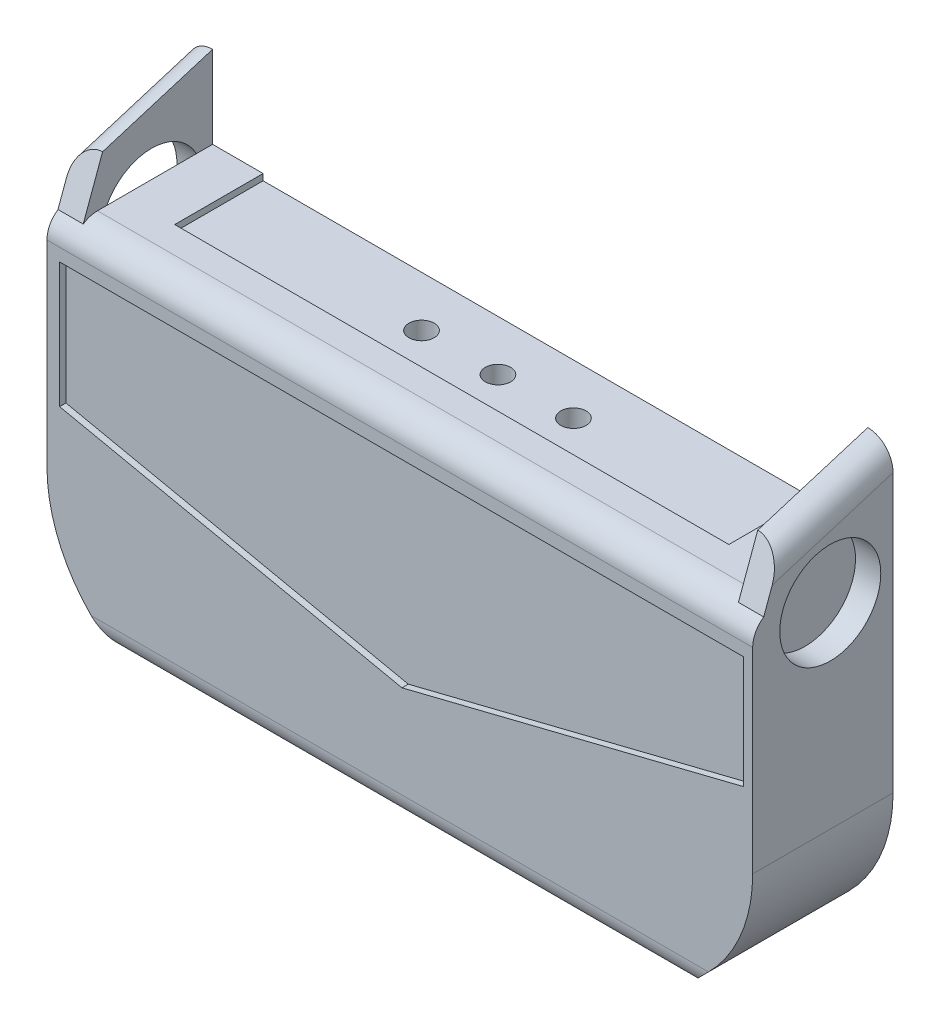
from build123d import *

# Parameters (mm, degrees)
SKETCH4_W                      = 111.737645783
SKETCH4_H                      = 62.825705526
BOSS_EXTRUDE3_DEPTH            = 20.22630919
SKETCH5_W                      = 103.737645783
SKETCH5_H                      = 6.825139403
CUT_EXTRUDE1_DEPTH             = 131.749158903
CUT_EXTRUDE2_DEPTH             = 131.749158903
SKETCH7_W                      = 87.737645783
SKETCH7_H                      = 14
CUT_EXTRUDE3_DEPTH             = 1
SKETCH8_W                      = 87.737645783
SKETCH8_H                      = 14
CUT_EXTRUDE4_DEPTH             = 1
DRAFT1_ANGLE                   = 17.058179216
F_16_0_16_DIAMETER_HOLE1_D     = 16
F_16_0_16_DIAMETER_HOLE1_DEPTH = 4
F_16_0_16_DIAMETER_HOLE2_D     = 16
F_16_0_16_DIAMETER_HOLE2_DEPTH = 4
F_4_0_4_DIAMETER_HOLE1_D       = 4
F_4_0_4_DIAMETER_HOLE1_DEPTH   = 6
F_4_0_4_DIAMETER_HOLE2_D       = 4
F_4_0_4_DIAMETER_HOLE2_DEPTH   = 68.031973705
M10_CLEARANCE_HOLE1_D          = 11.9
CHAMFER1_SIZE                  = 6.825139403
CHAMFER1_SIZE2                 = 2.933140798
CHAMFER2_SIZE                  = 6.825139403
CHAMFER2_SIZE2                 = 2.933140798
SKETCH19_W                     = 111.737645783
SKETCH19_H                     = 56.000566123
BOSS_EXTRUDE4_DEPTH            = 2
FILLET7_R                      = 4
CHAMFER3_SIZE                  = 11
CHAMFER4_SIZE                  = 11
FILLET9_R                      = 24
FILLET10_R                     = 24
CUT_EXTRUDE6_DEPTH             = 1
FILLET13_R                     = 4
FILLET14_R                     = 4
FILLET15_R                     = 4


# Some blends are built 0.0001 mm under size
with BuildPart() as part:
    # Sketch4 → Boss-Extrude3 (new body)
    with BuildSketch(Plane(origin=(0, 0, 67.988216463), x_dir=(-1, 0, 0), z_dir=(0, 0, -1))):
        with Locations((-27.467757585, 67.284935079)):
            Rectangle(SKETCH4_W, SKETCH4_H)
    extrude(amount=-BOSS_EXTRUDE3_DEPTH)

    # Sketch5 → Cut-Extrude1 (cut, through all)
    with BuildSketch(Plane.XY.offset(88.214525653)):
        with Locations((27.467757585, 95.285218141)):
            Rectangle(SKETCH5_W, SKETCH5_H)
    extrude(amount=-CUT_EXTRUDE1_DEPTH, mode=Mode.SUBTRACT)

    # Sketch6 → Cut-Extrude2 (cut, through all)
    with BuildSketch(Plane.XY.offset(88.214525653)):
        with BuildLine():
            Line((-21.401065306, 66.205832154), (-21.401065306, 42.872082316))
            Line((-21.401065306, 42.872082316), (76.336580477, 42.872082316))
            Line((76.336580477, 42.872082316), (76.336580477, 66.098543331))
            ThreePointArc((76.336580477, 66.098543331), (63.931745492, 73.877367201), (76.336580477, 81.65619107))
            Line((76.336580477, 81.65619107), (76.336580477, 84.872648439))
            Line((76.336580477, 84.872648439), (-21.401065306, 84.872648439))
            Line((-21.401065306, 84.872648439), (-21.401065306, 81.548902247))
            ThreePointArc((-21.401065306, 81.548902247), (-8.768867408, 73.877367201), (-21.401065306, 66.205832154))
        make_face()
    extrude(amount=-CUT_EXTRUDE2_DEPTH, mode=Mode.SUBTRACT)

    # Sketch7 → Cut-Extrude3 (cut)
    with BuildSketch(Plane(origin=(0, 91.872648439, 0), x_dir=(-1, 0, 0), z_dir=(0, 1, 0))):
        with Locations((-27.467757585, 74.988216463)):
            Rectangle(SKETCH7_W, SKETCH7_H)
    extrude(amount=-CUT_EXTRUDE3_DEPTH, mode=Mode.SUBTRACT)

    # Sketch8 → Cut-Extrude4 (cut)
    with BuildSketch(Plane.XZ.offset(-35.872082316)):
        with Locations((27.467757585, 74.988216463)):
            Rectangle(SKETCH8_W, SKETCH8_H)
    extrude(amount=-CUT_EXTRUDE4_DEPTH, mode=Mode.SUBTRACT)

    # Draft1
    draft1_faces = [part.faces().sort_by_distance(p)[0] for p in [
        (-26.401065306, 98.697787842, 78.101371058),
        (81.336580477, 98.697787842, 78.101371058),
    ]]
    draft(draft1_faces, Plane.XY.offset(88.214525653), DRAFT1_ANGLE)

    # Ø16.0 (16) Diameter Hole1
    with Locations(Plane.ZY.offset(28.401065306)):
        with Locations((77.644129293, 88.158482369)):
            Hole(F_16_0_16_DIAMETER_HOLE1_D / 2, depth=F_16_0_16_DIAMETER_HOLE1_DEPTH)

    # Ø16.0 (16) Diameter Hole2
    with Locations(Plane(origin=(83.336580477, 0, 0), x_dir=(0, 0, -1), z_dir=(1, 0, 0))):
        with Locations((-77.930295014, 87.866076089)):
            Hole(F_16_0_16_DIAMETER_HOLE2_D / 2, depth=F_16_0_16_DIAMETER_HOLE2_DEPTH)

    # Ø4.0 (4) Diameter Hole1
    with Locations(Plane(origin=(0, 90.872648439, 0), x_dir=(1, 0, 0), z_dir=(0, 1, 0))):
        with Locations((40.713339239, -75.969517026), (28.761431707, -75.969517026), (16.662423773, -75.969517026)):
            Hole(F_4_0_4_DIAMETER_HOLE1_D / 2, depth=F_4_0_4_DIAMETER_HOLE1_DEPTH)

    # Ø4.0 (4) Diameter Hole2
    with Locations(Plane(origin=(0, 36.872082316, 0), x_dir=(-1, 0, 0), z_dir=(0, -1, 0))):
        with Locations((-40.713339239, -75.969517026), (-28.761431707, -75.969517026), (-16.662423773, -75.969517026)):
            Hole(F_4_0_4_DIAMETER_HOLE2_D / 2, depth=F_4_0_4_DIAMETER_HOLE2_DEPTH)

    # M10 Clearance Hole1 (through all)
    with Locations(Plane(origin=(0, 0, 67.988216463), x_dir=(-1, 0, 0), z_dir=(0, 0, -1))):
        with Locations((-72.573135404, 73.877367201), (17.414428357, 73.877367201)):
            Hole(M10_CLEARANCE_HOLE1_D / 2)

    # Chamfer1
    chamfer1_edges = [part.edges().sort_by_distance(p)[0] for p in [
        (81.336580477, 98.697787842, 88.214525653),
    ]]
    chamfer1_side = [part.faces().sort_by_distance(p)[0] for p in [
        (27.467757585, 37.153970406, 88.214525653),
    ]]
    chamfer(chamfer1_edges, length=CHAMFER1_SIZE, length2=CHAMFER1_SIZE2, reference=chamfer1_side[0])

    # Chamfer2
    chamfer2_edges = [part.edges().sort_by_distance(p)[0] for p in [
        (-26.401065306, 98.697787842, 88.214525653),
    ]]
    chamfer2_side = [part.faces().sort_by_distance(p)[0] for p in [
        (82.054692387, 63.872365377, 88.214525653),
    ]]
    chamfer(chamfer2_edges, length=CHAMFER2_SIZE, length2=CHAMFER2_SIZE2, reference=chamfer2_side[0])

    # Sketch19 → Boss-Extrude4 (add)
    with BuildSketch(Plane.XY.offset(88.214525653)):
        with Locations((27.467757585, 63.872365378)):
            Rectangle(SKETCH19_W, SKETCH19_H)
    extrude(amount=BOSS_EXTRUDE4_DEPTH)

    # Fillet7
    # the kernel refuses this fillet: 4 mm, written as the material it takes off along each edge
    with BuildSketch(Plane(origin=(93.336580477, 91.872648439, 90.214525653), x_dir=(0, 0, -1), z_dir=(-1, 0, 0))) as fillet7_piece_1_section:
        with BuildLine():
            CenterArc((FILLET7_R, FILLET7_R), FILLET7_R, 180, 90)
            Line((0, FILLET7_R), (0, 0))
            Line((0, 0), (FILLET7_R, 0))
        make_face()
    fillet7_piece_1 = extrude(amount=131.737645784, mode=Mode.PRIVATE)
    fillet7_piece_1 = split(fillet7_piece_1, bisect_by=Plane(origin=(81.336580477, 90.577181296, 88.687181842), z_dir=(0, 0.34275303765814863, 0.9394255453074032)), keep=Keep.TOP, mode=Mode.PRIVATE)
    add(fillet7_piece_1, mode=Mode.SUBTRACT)
    with BuildSketch(Plane(origin=(93.336580477, 91.872648439, 90.214525653), x_dir=(0, 0, -1), z_dir=(-1, 0, 0))) as fillet7_piece_2_section:
        with BuildLine():
            CenterArc((FILLET7_R, FILLET7_R), FILLET7_R, 180, 90)
            Line((0, FILLET7_R), (0, 0))
            Line((0, 0), (FILLET7_R, 0))
        make_face()
    fillet7_piece_2 = extrude(amount=131.737645784, mode=Mode.PRIVATE)
    fillet7_piece_2 = split(fillet7_piece_2, bisect_by=Plane(origin=(-24.401065306, 91.673256094, 87.815354023), z_dir=(1, 0, 0)), keep=Keep.TOP, mode=Mode.PRIVATE)
    fillet7_piece_2 = split(fillet7_piece_2, bisect_by=Plane(origin=(79.336580477, 91.673256094, 87.815354023), z_dir=(-1, 0, 0)), keep=Keep.TOP, mode=Mode.PRIVATE)
    add(fillet7_piece_2, mode=Mode.SUBTRACT)

    # Chamfer3
    chamfer3_edges = [part.edges().sort_by_distance(p)[0] for p in [
        (83.336580477, 35.872082316, 79.101371058),
    ]]
    chamfer(chamfer3_edges, length=CHAMFER3_SIZE)

    # Chamfer4
    chamfer4_edges = [part.edges().sort_by_distance(p)[0] for p in [
        (-28.401065306, 35.872082316, 79.101371058),
    ]]
    chamfer(chamfer4_edges, length=CHAMFER4_SIZE)

    # Fillet9
    fillet9_edges = [part.edges().sort_by_distance(p)[0] for p in [
        (83.336580477, 46.872082316, 79.101371058),
    ]]
    fillet(fillet9_edges, radius=FILLET9_R)

    # Fillet10
    fillet10_edges = [part.edges().sort_by_distance(p)[0] for p in [
        (-28.401065306, 46.872082316, 79.101371058),
    ]]
    fillet(fillet10_edges, radius=FILLET10_R)

    # Sketch21 → Cut-Extrude6 (cut)
    with BuildSketch(Plane.XY.offset(90.214525653)):
        Polygon((-26.391485045, 85.865514682), (-26.391485045, 66.022635818), (27.807921223, 54.570460017), (81.893939612, 68.063617644), (81.893939612, 85.865514682), align=None)
    extrude(amount=-CUT_EXTRUDE6_DEPTH, mode=Mode.SUBTRACT)

    # Fillet13
    fillet13_edges = [part.edges().sort_by_distance(p)[0] for p in [
        (-28.401065306, 102.231129511, 76.699318929),
    ]]
    fillet(fillet13_edges, radius=FILLET13_R - 0.0001)  # a hair under: the kernel refuses the full size

    # Fillet14
    fillet14_edges = [part.edges().sort_by_distance(p)[0] for p in [
        (83.336580477, 102.231129511, 76.699318929),
    ]]
    fillet(fillet14_edges, radius=FILLET14_R - 0.0001)  # a hair under: the kernel refuses the full size

    # Fillet15
    fillet15_edges = [part.edges().sort_by_distance(p)[0] for p in [
        (27.467757585, 35.872082316, 90.214525653),
    ]]
    fillet(fillet15_edges, radius=FILLET15_R)


solid = part.part
